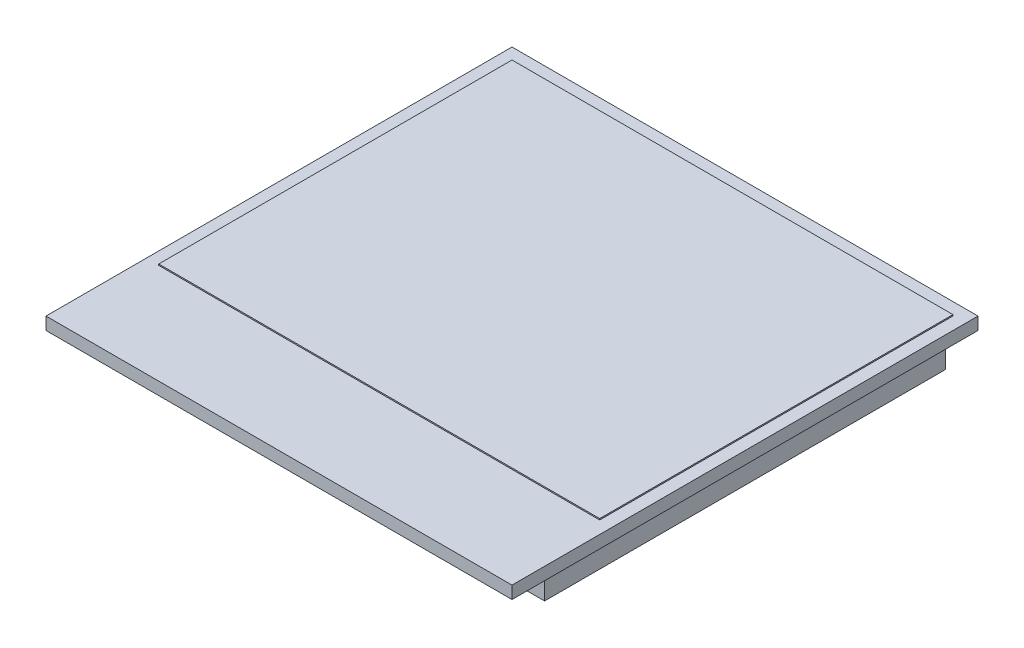
from build123d import *

# Parameters (mm, degrees)
SKETCH1_W         = 18.6
SKETCH1_H         = 18.6
GLASS_DEPTH       = 0.5
SKETCH2_W         = 17.6
SKETCH2_H         = 14.1
DISPLAY_DEPTH     = 0.05
SKETCH3_W         = 16
SKETCH3_H         = 16
STICKY_FOAM_DEPTH = 2


with BuildPart() as part:
    # Sketch1 → glass (new body)
    with BuildSketch(Plane(origin=(0, 0, 0), x_dir=(1, 0, 0), z_dir=(0, 1, 0))):
        with Locations((0, 9.3)):
            Rectangle(SKETCH1_W, SKETCH1_H)
    extrude(amount=GLASS_DEPTH)


with BuildPart() as body_2:
    # Sketch2 → display (new body)
    with BuildSketch(Plane(origin=(0, 0.5, 0), x_dir=(1, 0, 0), z_dir=(0, 1, 0))):
        with Locations((0, 11.05)):
            Rectangle(SKETCH2_W, SKETCH2_H)
    extrude(amount=DISPLAY_DEPTH)


with BuildPart() as body_3:
    # Sketch3 → sticky_foam (new body)
    with BuildSketch(Plane.XZ):
        with Locations((0, -10.6)):
            Rectangle(SKETCH3_W, SKETCH3_H)
    extrude(amount=STICKY_FOAM_DEPTH)


solid = Compound([part.part, body_2.part, body_3.part])
